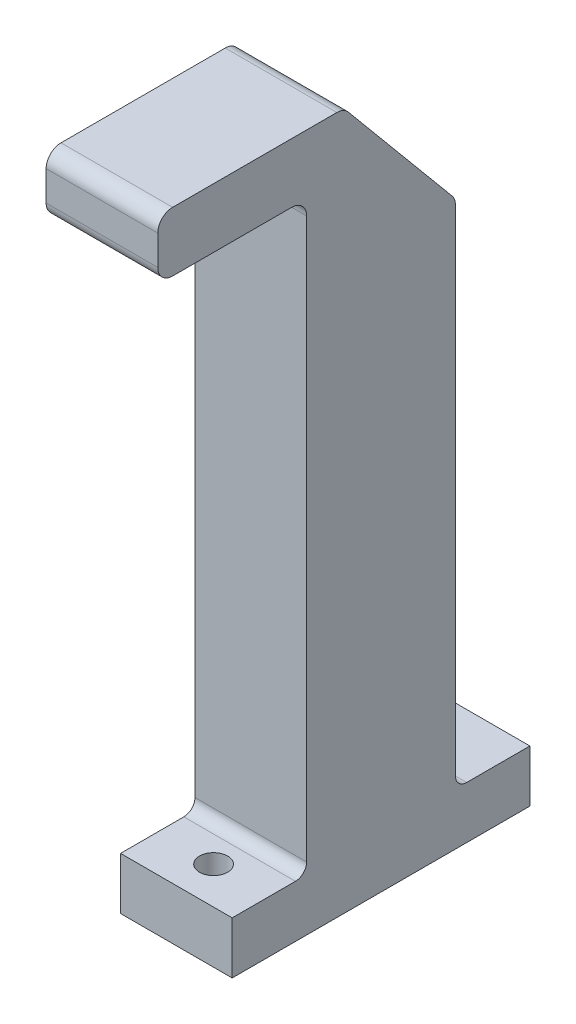
from build123d import *

# Parameters (mm, degrees)
BOSS_EXTRUDE1_DEPTH = 7.5
FILLET1_R           = 2
SKETCH4_W           = 15
SKETCH4_H           = 10
SKETCH4_R           = 1.6
SKETCH4_R_2         = 1.890816365
BOSS_EXTRUDE2_DEPTH = 7
FILLET2_R           = 1.5


with BuildPart() as part:
    # Sketch1 → Boss-Extrude1 (new, symmetric)
    with BuildSketch(Plane(origin=(0, 0, 0), x_dir=(0, 0, -1), z_dir=(1, 0, 0))):
        Polygon((0, 0), (0, 8), (25, 8), (40, -10), (40, -85.68), (20, -85.68), (20, 0), align=None)
    extrude(amount=BOSS_EXTRUDE1_DEPTH, both=True)

    # Fillet1
    fillet1_edges = [part.edges().sort_by_distance(p)[0] for p in [
        (0, -10, -40),
        (0, 8, -25),
        (0, 8, 0),
        (0, 0, 0),
        (0, 0, -20),
    ]]
    fillet(fillet1_edges, radius=FILLET1_R)

    # Sketch4 → Boss-Extrude2 (add)
    # profile 1 of 2: a face of its own
    with BuildSketch(Plane.XZ.offset(85.68)):
        with Locations((0, -45)):
            Rectangle(SKETCH4_W, SKETCH4_H)
        with Locations((0, -45)):
            Circle(SKETCH4_R, mode=Mode.SUBTRACT)
    # profile 2 of 2: a face of its own
    with BuildSketch(Plane.XZ.offset(85.68)):
        with Locations((0, -15)):
            Rectangle(SKETCH4_W, SKETCH4_H)
        with Locations((0, -15)):
            Circle(SKETCH4_R_2, mode=Mode.SUBTRACT)
    extrude(amount=-BOSS_EXTRUDE2_DEPTH)

    # Fillet2
    fillet2_edges = [part.edges().sort_by_distance(p)[0] for p in [
        (0, -78.68, -20),
        (0, -78.68, -40),
    ]]
    fillet(fillet2_edges, radius=FILLET2_R)


solid = part.part
